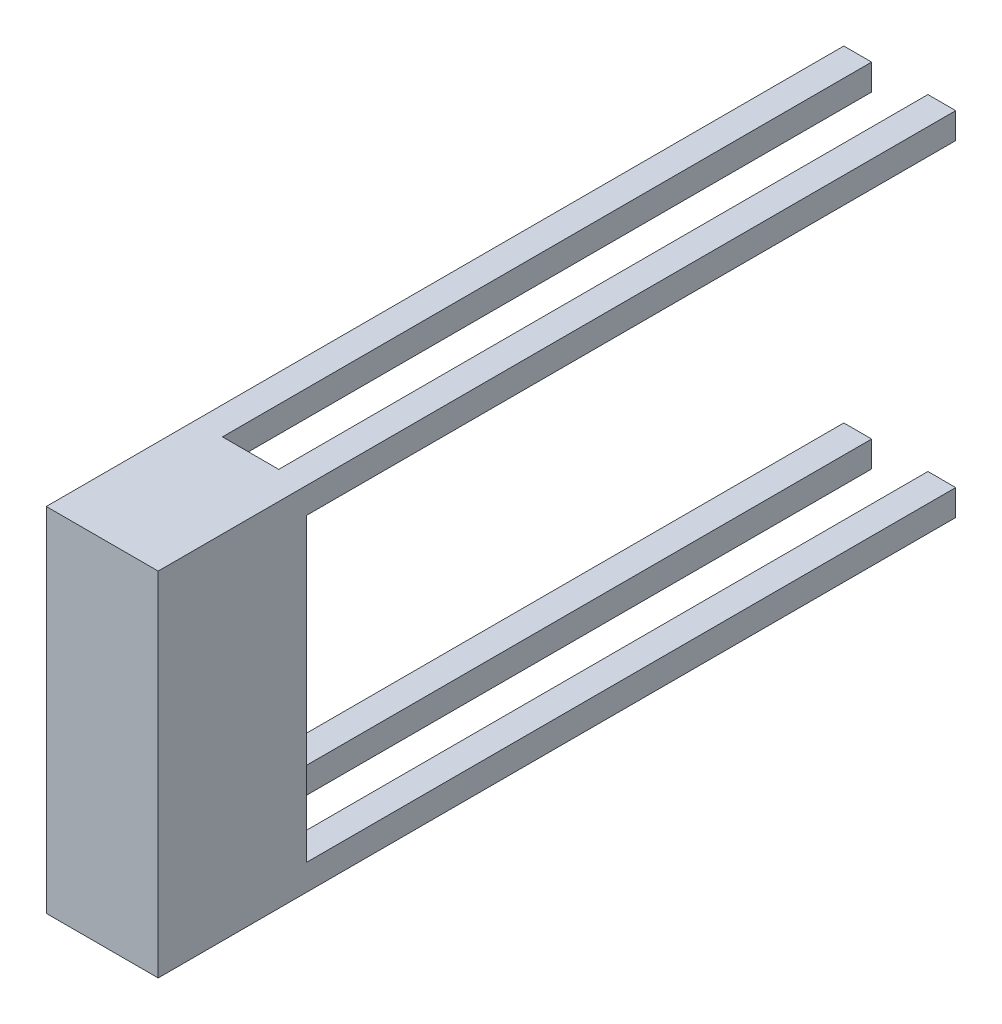
from build123d import *

# Parameters (mm, degrees)
SKETCH2_W             = 3
SKETCH2_H             = 2.8
BOSS_EXTRUDE1_DEPTH   = 70
BOSS_EXTRUDE1_2_DEPTH = 70
BOSS_EXTRUDE1_3_DEPTH = 70
BOSS_EXTRUDE1_4_DEPTH = 70
SKETCH3_W             = 12.066666666
SKETCH3_H             = 38
BOSS_EXTRUDE2_DEPTH   = 16


with BuildPart() as part:
    # Sketch2 → Boss-Extrude1 (new body)
    with BuildSketch(Plane.XY):
        with Locations((7.466666667, 1.4)):
            Rectangle(SKETCH2_W, SKETCH2_H)
    extrude(amount=-BOSS_EXTRUDE1_DEPTH)



with BuildPart() as body_2:
    # Sketch2 → Boss-Extrude1 2 (new body)
    with BuildSketch(Plane.XY):
        with Locations((16.533333333, 1.4)):
            Rectangle(SKETCH2_W, SKETCH2_H)
    extrude(amount=-BOSS_EXTRUDE1_2_DEPTH)


with BuildPart() as body_3:
    # Sketch2 → Boss-Extrude1 3 (new body)
    with BuildSketch(Plane.XY):
        with Locations((7.466666667, 36.6)):
            Rectangle(SKETCH2_W, SKETCH2_H)
    extrude(amount=-BOSS_EXTRUDE1_3_DEPTH)


with BuildPart() as body_4:
    # Sketch2 → Boss-Extrude1 4 (new body)
    with BuildSketch(Plane.XY):
        with Locations((16.533333333, 36.6)):
            Rectangle(SKETCH2_W, SKETCH2_H)
    extrude(amount=-BOSS_EXTRUDE1_4_DEPTH)


with BuildPart() as part_1:
    add(part.part)

    add(body_2.part)  # Boss-Extrude2 merges body 2

    add(body_3.part)  # Boss-Extrude2 merges body 3

    add(body_4.part)  # Boss-Extrude2 merges body 4
    # Sketch3 → Boss-Extrude2 (add)
    with BuildSketch(Plane.XY):
        with Locations((12, 19)):
            Rectangle(SKETCH3_W, SKETCH3_H)
    extrude(amount=BOSS_EXTRUDE2_DEPTH)


solid = part_1.part
